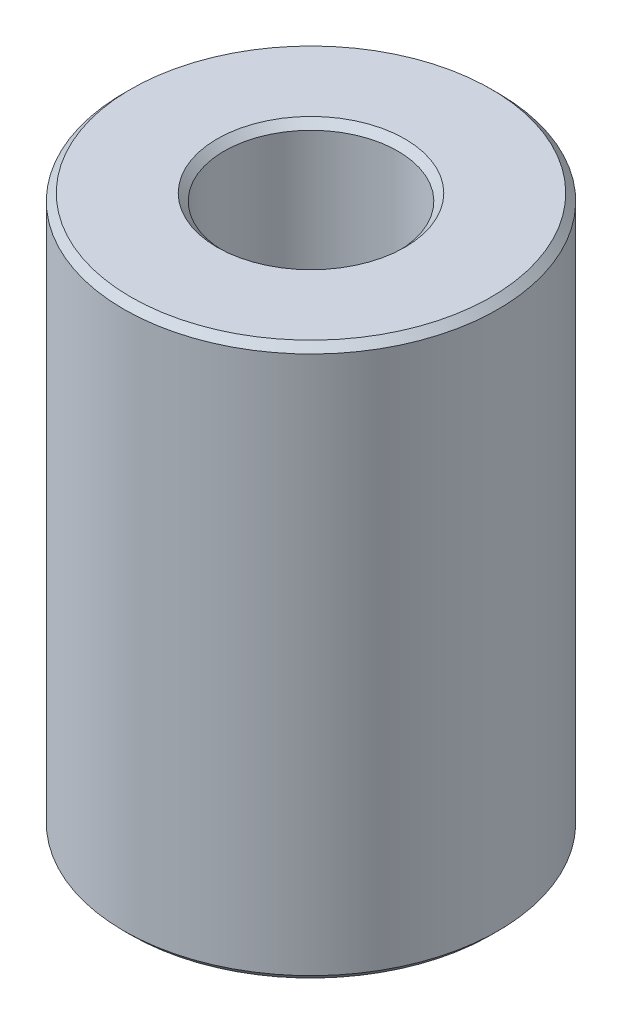
from build123d import *

# Parameters (mm, degrees)
SKETCH1_R           = 47.5
BOSS_EXTRUDE1_DEPTH = 140.190415542
SKETCH2_R           = 22.045183909
CUT_EXTRUDE1_DEPTH  = 156.453699248
CHAMFER1_SIZE       = 1.785194215


with BuildPart() as part:
    # Sketch1 → Boss-Extrude1 (new body)
    with BuildSketch(Plane(origin=(0, 0, 0), x_dir=(1, 0, 0), z_dir=(0, 1, 0))):
        Circle(SKETCH1_R)
    extrude(amount=BOSS_EXTRUDE1_DEPTH)

    # Sketch2 → Cut-Extrude1 (cut, through all)
    with BuildSketch(Plane(origin=(0, 0, 0), x_dir=(1, 0, 0), z_dir=(0, 1, 0))):
        Circle(SKETCH2_R)
    extrude(amount=CUT_EXTRUDE1_DEPTH, mode=Mode.SUBTRACT)

    # Chamfer1
    chamfer1_edges = [part.edges().sort_by_distance(p)[0] for p in [
        (-22.045183909, 140.190415542, 0),
        (-22.045183909, 0, 0),
        (-47.5, 0, 0),
        (-47.5, 140.190415542, 0),
    ]]
    chamfer(chamfer1_edges, length=CHAMFER1_SIZE)


solid = part.part
